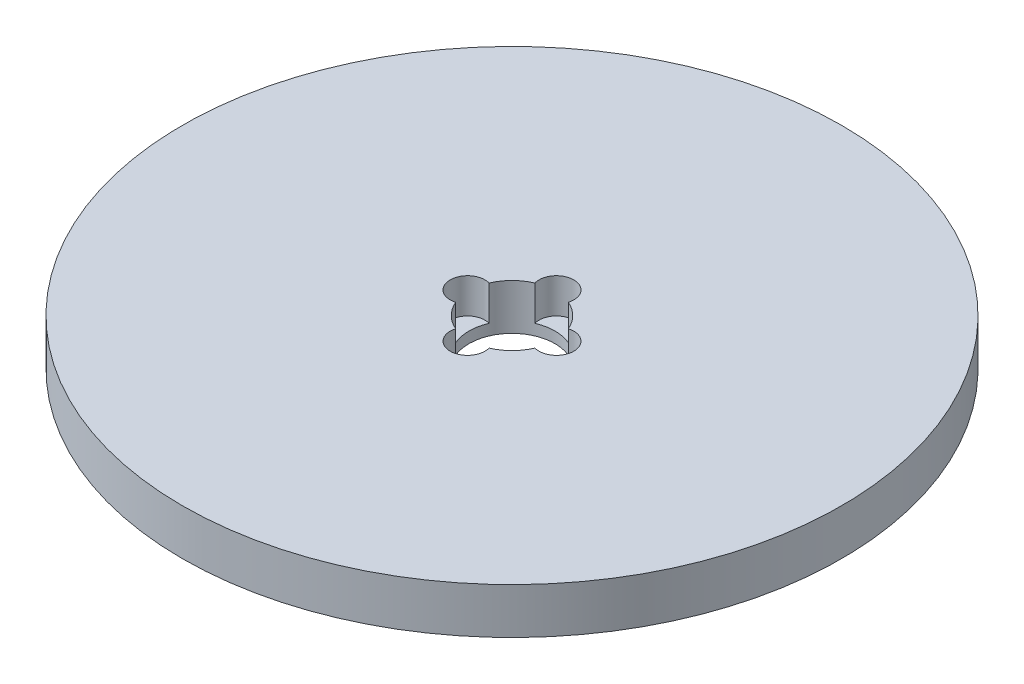
from build123d import *

# Parameters (mm, degrees)
SKETCH1_R           = 57.5
BOSS_EXTRUDE1_DEPTH = 8
SKETCH2_R           = 7.5
CUT_EXTRUDE1_DEPTH  = 82.709852527
SKETCH3_R           = 3.033414286
CUT_EXTRUDE2_DEPTH  = 6.087077547
CIRPATTERN1_COUNT   = 4


with BuildPart() as part:
    # Sketch1 → Boss-Extrude1 (new body)
    with BuildSketch(Plane(origin=(0, 0, 0), x_dir=(1, 0, 0), z_dir=(0, 1, 0))):
        Circle(SKETCH1_R)
    extrude(amount=BOSS_EXTRUDE1_DEPTH)

    # Sketch2 → Cut-Extrude1 (cut, through all)
    with BuildSketch(Plane(origin=(0, 0, 0), x_dir=(1, 0, 0), z_dir=(0, 1, 0))):
        Circle(SKETCH2_R)
    extrude(amount=CUT_EXTRUDE1_DEPTH, mode=Mode.SUBTRACT)

    # Sketch3 → Cut-Extrude2 (cut)
    with BuildSketch(Plane(origin=(0, 8, 0), x_dir=(1, 0, 0), z_dir=(0, 1, 0))):
        with Locations((-7.751118919, 0)):
            Circle(SKETCH3_R)
    cut_extrude2 = extrude(amount=-CUT_EXTRUDE2_DEPTH, mode=Mode.SUBTRACT)

    # CirPattern1: Cut-Extrude2 ×4 about axis
    cirpattern1_axis = Axis((0, 0, 0), (0, 1, 0))
    for i in range(1, CIRPATTERN1_COUNT):
        add(cut_extrude2.rotate(cirpattern1_axis, i * 360 / CIRPATTERN1_COUNT), mode=Mode.SUBTRACT)


solid = part.part
